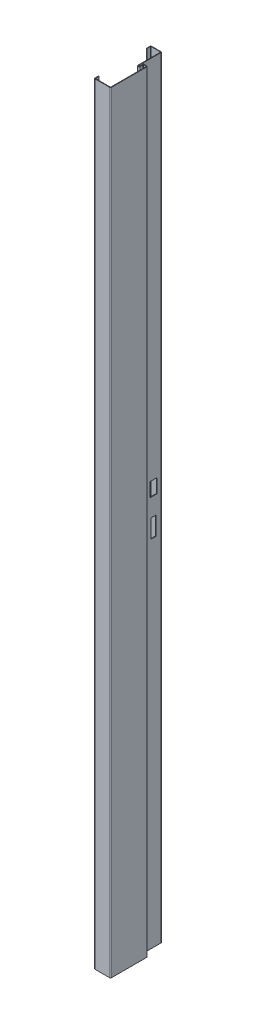
from build123d import *

# Parameters (mm, degrees)
BASE_FLANGE1_DEPTH = 1050
SKETCH2_W          = 18
SKETCH2_H          = 38
SKETCH2_W_2        = 13
SKETCH2_H_2        = 50
CUT_EXTRUDE1_DEPTH = 10


# Sheet-metal steps are written as plain solids
with BuildPart() as part:
    # Sketch1 → Base-Flange1 (new, symmetric)
    with BuildSketch(Plane(origin=(0, 0, 0), x_dir=(1, 0, 0), z_dir=(0, 1, 0))):
        with BuildLine():
            Line((-15, 65), (-15, 74.7634))
            ThreePointArc((-15, 74.7634), (-14.344915027, 76.344915027), (-12.7634, 77))
            Line((-12.7634, 77), (12.7634, 77))
            ThreePointArc((12.7634, 77), (14.344915027, 76.344915027), (15, 74.7634))
            Line((15, 74.7634), (15, 30))
            Line((15, 30), (15, 24))
            Line((15, 24), (15, 13.8))
            ThreePointArc((15, 13.8), (16.769678139, 12.091041686), (18.415834526, 13.91928357))
            Line((18.415834526, 13.91928357), (17.878230266, 21.607382671))
            ThreePointArc((17.878230266, 21.607382671), (18.473636332, 23.288757532), (20.109382021, 24))
            Line((20.109382021, 24), (27.2634, 24))
            ThreePointArc((27.2634, 24), (28.844915027, 23.344915027), (29.5, 21.7634))
            Line((29.5, 21.7634), (29.5, -30))
            Line((29.5, -30), (29.5, -74.7634))
            ThreePointArc((29.5, -74.7634), (28.844915027, -76.344915027), (27.2634, -77))
            Line((27.2634, -77), (15, -77))
            Line((15, -77), (-12.7634, -77))
            ThreePointArc((-12.7634, -77), (-14.344915027, -76.344915027), (-15, -74.7634))
            Line((-15, -74.7634), (-15, -65))
            Line((-15, -65), (-13.5, -65))
            Line((-13.5, -65), (-13.5, -74.7634))
            ThreePointArc((-13.5, -74.7634), (-13.284254855, -75.284254855), (-12.7634, -75.5))
            Line((-12.7634, -75.5), (15, -75.5))
            Line((15, -75.5), (27.2634, -75.5))
            ThreePointArc((27.2634, -75.5), (27.784254855, -75.284254855), (28, -74.7634))
            Line((28, -74.7634), (28, -30))
            Line((28, -30), (28, 21.7634))
            ThreePointArc((28, 21.7634), (27.784254855, 22.284254855), (27.2634, 22.5))
            Line((27.2634, 22.5), (20.109382021, 22.5))
            ThreePointArc((20.109382021, 22.5), (19.570666884, 22.265759992), (19.374576341, 21.712017381))
            Line((19.374576341, 21.712017381), (19.912180601, 14.023918281))
            ThreePointArc((19.912180601, 14.023918281), (16.822027384, 10.591955445), (13.5, 13.8))
            Line((13.5, 13.8), (13.5, 24))
            Line((13.5, 24), (13.5, 30))
            Line((13.5, 30), (13.5, 74.7634))
            ThreePointArc((13.5, 74.7634), (13.284254855, 75.284254855), (12.7634, 75.5))
            Line((12.7634, 75.5), (-12.7634, 75.5))
            ThreePointArc((-12.7634, 75.5), (-13.284254855, 75.284254855), (-13.5, 74.7634))
            Line((-13.5, 74.7634), (-13.5, 65))
            Line((-13.5, 65), (-15, 65))
        make_face()
    extrude(amount=BASE_FLANGE1_DEPTH, both=True)

    # Sketch2 → Cut-Extrude1 (cut)
    with BuildSketch(Plane(origin=(15, 0, 0), x_dir=(0, 0, -1), z_dir=(1, 0, 0))):
        with Locations((54.5, 34)):
            Rectangle(SKETCH2_W, SKETCH2_H)
        with Locations((54.5, -59)):
            Rectangle(SKETCH2_W_2, SKETCH2_H_2)
    extrude(amount=-CUT_EXTRUDE1_DEPTH, mode=Mode.SUBTRACT)


solid = part.part
